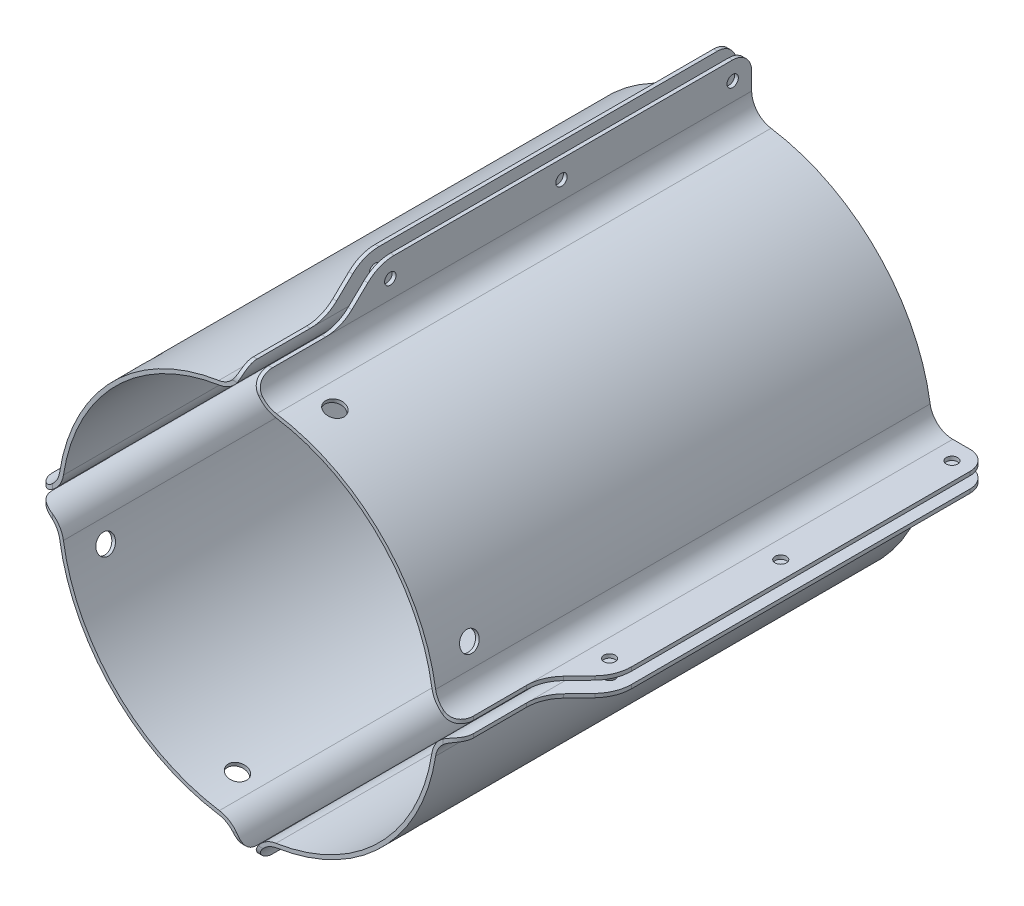
from build123d import *

# Parameters (mm, degrees)
EXTRUDE_1_DEPTH          = 130
EXTRUDE_1_2_DEPTH        = 130
EXTRUDE_1_3_DEPTH        = 130
EXTRUDE_1_4_DEPTH        = 130
SKETCH_2_R               = 1.5
CUT_EXTRUDE_1_DEPTH      = 130
FILLET_1_R               = 4
FILLET_2_R               = 4
FILLET_5_R               = 10
FILLET_6_R               = 10
FILLET_7_R               = 5
FILLET_8_R               = 5
CUT_EXTRUDE_START        = -5
SKETCH_3_R               = 1.5
CUT_EXTRUDE_2_DEPTH      = 5
PATTERN_CIRCULAR_6_COUNT = 4
FILLET_9_R               = 4
FILLET_10_R              = 10
FILLET_11_R              = 5
FILLET_12_R              = 5
FILLET_13_R              = 4
FILLET_14_R              = 10
FILLET_15_R              = 5
FILLET_16_R              = 5
FILLET_17_R              = 10
FILLET_18_R              = 10
FILLET_19_R              = 4
FILLET_20_R              = 10
FILLET_21_R              = 4
SKETCH_4_R               = 2.5
CUT_EXTRUDE_3_DEPTH      = 160.165786774
PATTERN_CIRCULAR_7_COUNT = 6


with BuildPart() as part:
    # Эскиз1 → Бобышка-Вытянуть1 (new body)
    with BuildSketch(Plane.XY):
        with BuildLine():
            Line((2.5, 55.35115175), (2.5, 64.937460889))
            Line((2.5, 64.937460889), (1.5, 64.937460889))
            Line((1.5, 64.937460889), (1.5, 55.35115175))
            ThreePointArc((1.5, 55.35115175), (3.18786766, 50.792506117), (7.4375, 48.432257781))
            ThreePointArc((7.4375, 48.432257781), (34.648232278, 34.648232278), (48.432257781, 7.4375))
            ThreePointArc((48.432257781, 7.4375), (50.792506117, 3.18786766), (55.35115175, 1.5))
            Line((55.35115175, 1.5), (64.937460889, 1.5))
            Line((64.937460889, 1.5), (64.937460889, 2.5))
            Line((64.937460889, 2.5), (55.35115175, 2.5))
            ThreePointArc((55.35115175, 2.5), (51.443741208, 3.946743708), (49.420671205, 7.589285714))
            ThreePointArc((49.420671205, 7.589285714), (35.355339059, 35.355339059), (7.589285714, 49.420671205))
            ThreePointArc((7.589285714, 49.420671205), (3.946743708, 51.443741208), (2.5, 55.35115175))
        make_face()
    extrude(amount=EXTRUDE_1_DEPTH)


with BuildPart() as body_2:
    # Эскиз1 → Extrude 1 2 (new body)
    with BuildSketch(Plane.XY):
        with BuildLine():
            Line((-1.5, 64.937460889), (-2.5, 64.937460889))
            Line((-2.5, 64.937460889), (-2.5, 55.35115175))
            ThreePointArc((-2.5, 55.35115175), (-3.946743708, 51.443741208), (-7.589285714, 49.420671205))
            ThreePointArc((-7.589285714, 49.420671205), (-35.355339059, 35.355339059), (-49.420671205, 7.589285714))
            ThreePointArc((-49.420671205, 7.589285714), (-51.443741208, 3.946743708), (-55.35115175, 2.5))
            Line((-55.35115175, 2.5), (-64.937460889, 2.5))
            Line((-64.937460889, 2.5), (-64.937460889, 1.5))
            Line((-64.937460889, 1.5), (-55.35115175, 1.5))
            ThreePointArc((-55.35115175, 1.5), (-50.792506117, 3.18786766), (-48.432257781, 7.4375))
            ThreePointArc((-48.432257781, 7.4375), (-34.648232278, 34.648232278), (-7.4375, 48.432257781))
            ThreePointArc((-7.4375, 48.432257781), (-3.18786766, 50.792506117), (-1.5, 55.35115175))
            Line((-1.5, 55.35115175), (-1.5, 64.937460889))
        make_face()
    extrude(amount=EXTRUDE_1_2_DEPTH)


with BuildPart() as body_3:
    # Эскиз1 → Extrude 1 3 (new body)
    with BuildSketch(Plane.XY):
        with BuildLine():
            Line((55.35115175, -2.5), (64.937460889, -2.5))
            Line((64.937460889, -2.5), (64.937460889, -1.5))
            Line((64.937460889, -1.5), (55.35115175, -1.5))
            ThreePointArc((55.35115175, -1.5), (50.792506117, -3.18786766), (48.432257781, -7.4375))
            ThreePointArc((48.432257781, -7.4375), (34.648232278, -34.648232278), (7.4375, -48.432257781))
            ThreePointArc((7.4375, -48.432257781), (3.18786766, -50.792506117), (1.5, -55.35115175))
            Line((1.5, -55.35115175), (1.5, -64.937460889))
            Line((1.5, -64.937460889), (2.5, -64.937460889))
            Line((2.5, -64.937460889), (2.5, -55.35115175))
            ThreePointArc((2.5, -55.35115175), (3.946743708, -51.443741208), (7.589285714, -49.420671205))
            ThreePointArc((7.589285714, -49.420671205), (35.355339059, -35.355339059), (49.420671205, -7.589285714))
            ThreePointArc((49.420671205, -7.589285714), (51.443741208, -3.946743708), (55.35115175, -2.5))
        make_face()
    extrude(amount=EXTRUDE_1_3_DEPTH)


with BuildPart() as body_4:
    # Эскиз1 → Extrude 1 4 (new body)
    with BuildSketch(Plane.XY):
        with BuildLine():
            Line((-2.5, -55.35115175), (-2.5, -64.937460889))
            Line((-2.5, -64.937460889), (-1.5, -64.937460889))
            Line((-1.5, -64.937460889), (-1.5, -55.35115175))
            ThreePointArc((-1.5, -55.35115175), (-3.18786766, -50.792506117), (-7.4375, -48.432257781))
            ThreePointArc((-7.4375, -48.432257781), (-34.648232278, -34.648232278), (-48.432257781, -7.4375))
            ThreePointArc((-48.432257781, -7.4375), (-50.792506117, -3.18786766), (-55.35115175, -1.5))
            Line((-55.35115175, -1.5), (-64.937460889, -1.5))
            Line((-64.937460889, -1.5), (-64.937460889, -2.5))
            Line((-64.937460889, -2.5), (-55.35115175, -2.5))
            ThreePointArc((-55.35115175, -2.5), (-51.443741208, -3.946743708), (-49.420671205, -7.589285714))
            ThreePointArc((-49.420671205, -7.589285714), (-35.355339059, -35.355339059), (-7.589285714, -49.420671205))
            ThreePointArc((-7.589285714, -49.420671205), (-3.946743708, -51.443741208), (-2.5, -55.35115175))
        make_face()
    extrude(amount=EXTRUDE_1_4_DEPTH)


with BuildPart() as cut_extrude_1_tool:
    # Эскиз2 → Вырез-Вытянуть1 (new body)
    with BuildSketch(Plane(origin=(2.5, 0, 0), x_dir=(0, 0, -1), z_dir=(1, 0, 0))):
        with Locations((-5, 60.144306319)):
            Circle(SKETCH_2_R)
        with Locations((-50, 60.144306319)):
            Circle(SKETCH_2_R)
        with Locations((-95, 60.144306319)):
            Circle(SKETCH_2_R)
        Polygon((-130, 64.937460889), (-98, 64.937460889), (-108, 55.35115175), (-130, 55.35115175), align=None)
    extrude(amount=-CUT_EXTRUDE_1_DEPTH)


with BuildPart() as part_1:
    add(part.part)

    # Вырез-Вытянуть1: cut by cut_extrude_1_tool
    add(cut_extrude_1_tool.part, mode=Mode.SUBTRACT)

    # Скругление1
    # the kernel refuses this fillet: 4 mm, written as the material it takes off along each edge
    with BuildSketch(Plane(origin=(12.5, 55.35115175, 130), x_dir=(0, 0, -1), z_dir=(-1, 0, 0))) as fillet_1_piece_1:
        with BuildLine():
            CenterArc((FILLET_1_R, FILLET_1_R), FILLET_1_R, 180, 90)
            Line((0, FILLET_1_R), (0, 0))
            Line((0, 0), (FILLET_1_R, 0))
        make_face()
    extrude(amount=21, mode=Mode.SUBTRACT)

    # Скругление6
    fillet_6_edges = [part_1.edges().sort_by_distance(p)[0] for p in [
        (2, 64.937460889, 98),
    ]]
    fillet(fillet_6_edges, radius=FILLET_6_R)

    # Скругление8
    fillet_8_edges = [part_1.edges().sort_by_distance(p)[0] for p in [
        (2, 64.937460889, 0),
    ]]
    fillet(fillet_8_edges, radius=FILLET_8_R)


with BuildPart() as body_2_1:
    add(body_2.part)

    # Вырез-Вытянуть1: cut by cut_extrude_1_tool
    add(cut_extrude_1_tool.part, mode=Mode.SUBTRACT)

    # Скругление2
    # the kernel refuses this fillet: 4 mm, written as the material it takes off along each edge
    with BuildSketch(Plane(origin=(8.5, 55.35115175, 130), x_dir=(0, 0, -1), z_dir=(-1, 0, 0))) as fillet_2_piece_1:
        with BuildLine():
            CenterArc((FILLET_2_R, FILLET_2_R), FILLET_2_R, 180, 90)
            Line((0, FILLET_2_R), (0, 0))
            Line((0, 0), (FILLET_2_R, 0))
        make_face()
    extrude(amount=21, mode=Mode.SUBTRACT)

    # Скругление5
    fillet_5_edges = [body_2_1.edges().sort_by_distance(p)[0] for p in [
        (-2, 64.937460889, 98),
    ]]
    fillet(fillet_5_edges, radius=FILLET_5_R)

    # Скругление7
    fillet_7_edges = [body_2_1.edges().sort_by_distance(p)[0] for p in [
        (-2, 64.937460889, 0),
    ]]
    fillet(fillet_7_edges, radius=FILLET_7_R)


with BuildPart() as cut_extrude_2_tool:
    # Эскиз3 → Вырез-Вытянуть2 (new body)
    with BuildSketch(Plane(origin=(0, 2.5, 0), x_dir=(1, 0, 0), z_dir=(0, 1, 0)).offset(CUT_EXTRUDE_START)):
        with Locations(Location((-60.144306319, -5, 0), (0, 0, 180))):
            Circle(SKETCH_3_R)
        with Locations(Location((-60.144306319, -50, 0), (0, 0, 180))):
            Circle(SKETCH_3_R)
        with Locations(Location((-60.144306319, -95, 0), (0, 0, 180))):
            Circle(SKETCH_3_R)
        Polygon((-64.937460889, -130), (-64.937460889, -98), (-55.35115175, -108), (-55.35115175, -130), align=None)
    cut_extrude_2 = extrude(amount=CUT_EXTRUDE_2_DEPTH)


with BuildPart() as body_2_2:
    add(body_2_1.part)

    # Вырез-Вытянуть2: cut by cut_extrude_2_tool
    add(cut_extrude_2_tool.part, mode=Mode.SUBTRACT)

    # Скругление9
    # the kernel refuses this fillet: 4 mm, written as the material it takes off along each edge
    with BuildSketch(Plane(origin=(-55.35115175, -8.5, 130), x_dir=(1, 0, 0), z_dir=(0, 1, 0))) as fillet_9_piece_1:
        with BuildLine():
            CenterArc((FILLET_9_R, FILLET_9_R), FILLET_9_R, 180, 90)
            Line((0, FILLET_9_R), (0, 0))
            Line((0, 0), (FILLET_9_R, 0))
        make_face()
    extrude(amount=21, mode=Mode.SUBTRACT)

    # Скругление10
    fillet_10_edges = [body_2_2.edges().sort_by_distance(p)[0] for p in [
        (-64.937460889, 2, 98),
        (-55.35115175, 2, 108),
    ]]
    fillet(fillet_10_edges, radius=FILLET_10_R)

    # Скругление11
    fillet_11_edges = [body_2_2.edges().sort_by_distance(p)[0] for p in [
        (-64.937460889, 2, 0),
    ]]
    fillet(fillet_11_edges, radius=FILLET_11_R)

    # Скругление18
    fillet_18_edges = [body_2_2.edges().sort_by_distance(p)[0] for p in [
        (-2, 55.35115175, 108),
    ]]
    fillet(fillet_18_edges, radius=FILLET_18_R)


with BuildPart() as body_4_1:
    add(body_4.part)

    # Вырез-Вытянуть2: cut by cut_extrude_2_tool
    add(cut_extrude_2_tool.part, mode=Mode.SUBTRACT)


with BuildPart() as pattern_circular_6_tool:
    # Круговой массив6: Вырез-Вытянуть2 ×4 about axis
    pattern_circular_6_axis = Axis((0, 0, 130), (0, 0, -1))
    for i in range(1, PATTERN_CIRCULAR_6_COUNT):
        add(cut_extrude_2.rotate(pattern_circular_6_axis, i * 360 / PATTERN_CIRCULAR_6_COUNT))


with BuildPart() as part_2:
    add(part_1.part)

    # Круговой массив6: cut by pattern_circular_6_tool
    add(pattern_circular_6_tool.part, mode=Mode.SUBTRACT)

    # Скругление16
    fillet_16_edges = [part_2.edges().sort_by_distance(p)[0] for p in [
        (64.937460889, 2, 0),
    ]]
    fillet(fillet_16_edges, radius=FILLET_16_R)

    # Скругление17
    fillet_17_edges = [part_2.edges().sort_by_distance(p)[0] for p in [
        (64.937460889, 2, 98),
        (55.35115175, 2, 108),
        (2, 55.35115175, 108),
    ]]
    fillet(fillet_17_edges, radius=FILLET_17_R)

    # Скругление19
    # the kernel refuses this fillet: 4 mm, written as the material it takes off along each edge
    with BuildSketch(Plane(origin=(55.35115175, 12.5, 130), x_dir=(-1, 0, 0), z_dir=(0, -1, 0))) as fillet_19_piece_1:
        with BuildLine():
            CenterArc((FILLET_19_R, FILLET_19_R), FILLET_19_R, 180, 90)
            Line((0, FILLET_19_R), (0, 0))
            Line((0, 0), (FILLET_19_R, 0))
        make_face()
    extrude(amount=21, mode=Mode.SUBTRACT)


with BuildPart() as body_3_1:
    add(body_3.part)

    # Круговой массив6: cut by pattern_circular_6_tool
    add(pattern_circular_6_tool.part, mode=Mode.SUBTRACT)

    # Скругление15
    fillet_15_edges = [body_3_1.edges().sort_by_distance(p)[0] for p in [
        (2, -64.937460889, 0),
        (64.937460889, -2, 0),
    ]]
    fillet(fillet_15_edges, radius=FILLET_15_R)

    # Скругление20
    fillet_20_edges = [body_3_1.edges().sort_by_distance(p)[0] for p in [
        (64.937460889, -2, 98),
        (55.35115175, -2, 108),
        (2, -64.937460889, 98),
        (2, -55.35115175, 108),
    ]]
    fillet(fillet_20_edges, radius=FILLET_20_R)

    # Скругление21
    # the kernel refuses this fillet: 4 mm, written as the material it takes off along each edge
    with BuildSketch(Plane(origin=(55.35115175, 8.5, 130), x_dir=(-1, 0, 0), z_dir=(0, -1, 0))) as fillet_21_piece_1:
        with BuildLine():
            CenterArc((FILLET_21_R, FILLET_21_R), FILLET_21_R, 180, 90)
            Line((0, FILLET_21_R), (0, 0))
            Line((0, 0), (FILLET_21_R, 0))
        make_face()
    extrude(amount=21, mode=Mode.SUBTRACT)
    with BuildSketch(Plane(origin=(12.5, -55.35115175, 130), x_dir=(0, 0, -1), z_dir=(-1, 0, 0))) as fillet_21_piece_2:
        with BuildLine():
            CenterArc((FILLET_21_R, -FILLET_21_R), FILLET_21_R, 90, 90)
            Line((0, -FILLET_21_R), (0, 0))
            Line((0, 0), (FILLET_21_R, 0))
        make_face()
    extrude(amount=21, mode=Mode.SUBTRACT)

    # Эскиз4 → Вырез-Вытянуть3 (cut, through all)
    with BuildSketch(Plane(origin=(0, 0, 0), x_dir=(0.7071067811865477, 0.7071067811865475, 0), z_dir=(-0.7071067811865475, 0.7071067811865477, 0))):
        with Locations(Location((0, -120, 0), (0, 0, 180))):
            Circle(SKETCH_4_R)
    cut_extrude_3 = extrude(amount=-CUT_EXTRUDE_3_DEPTH, mode=Mode.SUBTRACT)


with BuildPart() as body_4_2:
    add(body_4_1.part)

    # Круговой массив6: cut by pattern_circular_6_tool
    add(pattern_circular_6_tool.part, mode=Mode.SUBTRACT)

    # Скругление12
    fillet_12_edges = [body_4_2.edges().sort_by_distance(p)[0] for p in [
        (-64.937460889, -2, 0),
        (-2, -64.937460889, 0),
    ]]
    fillet(fillet_12_edges, radius=FILLET_12_R)

    # Скругление13
    # the kernel refuses this fillet: 4 mm, written as the material it takes off along each edge
    with BuildSketch(Plane(origin=(8.5, -55.35115175, 130), x_dir=(0, 0, -1), z_dir=(-1, 0, 0))) as fillet_13_piece_1:
        with BuildLine():
            CenterArc((FILLET_13_R, -FILLET_13_R), FILLET_13_R, 90, 90)
            Line((0, -FILLET_13_R), (0, 0))
            Line((0, 0), (FILLET_13_R, 0))
        make_face()
    extrude(amount=21, mode=Mode.SUBTRACT)
    with BuildSketch(Plane(origin=(-55.35115175, -12.5, 130), x_dir=(1, 0, 0), z_dir=(0, 1, 0))) as fillet_13_piece_2:
        with BuildLine():
            CenterArc((FILLET_13_R, FILLET_13_R), FILLET_13_R, 180, 90)
            Line((0, FILLET_13_R), (0, 0))
            Line((0, 0), (FILLET_13_R, 0))
        make_face()
    extrude(amount=21, mode=Mode.SUBTRACT)

    # Скругление14
    fillet_14_edges = [body_4_2.edges().sort_by_distance(p)[0] for p in [
        (-2, -64.937460889, 98),
        (-2, -55.35115175, 108),
        (-64.937460889, -2, 98),
        (-55.35115175, -2, 108),
    ]]
    fillet(fillet_14_edges, radius=FILLET_14_R)


with BuildPart() as pattern_circular_7_tool:
    # Круговой массив7: Вырез-Вытянуть3 ×6 about axis
    pattern_circular_7_axis = Axis((0, 0, 130), (0, 0, -1))
    for i in range(1, PATTERN_CIRCULAR_7_COUNT):
        add(cut_extrude_3.rotate(pattern_circular_7_axis, i * 360 / PATTERN_CIRCULAR_7_COUNT))


with BuildPart() as part_3:
    add(part_2.part)

    # Круговой массив7: cut by pattern_circular_7_tool
    add(pattern_circular_7_tool.part, mode=Mode.SUBTRACT)


with BuildPart() as body_2_3:
    add(body_2_2.part)

    # Круговой массив7: cut by pattern_circular_7_tool
    add(pattern_circular_7_tool.part, mode=Mode.SUBTRACT)


with BuildPart() as body_4_3:
    add(body_4_2.part)

    # Круговой массив7: cut by pattern_circular_7_tool
    add(pattern_circular_7_tool.part, mode=Mode.SUBTRACT)


solid = Compound([body_3_1.part, part_3.part, body_2_3.part, body_4_3.part])
